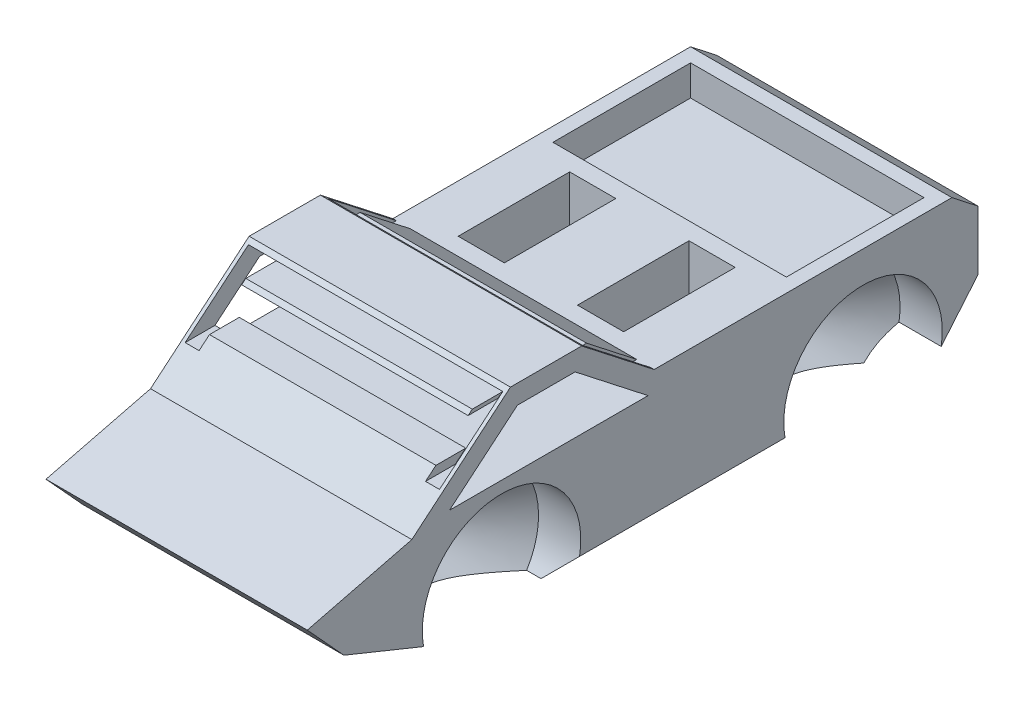
from build123d import *

# Parameters (mm, degrees)
BOSS_EXTRUDE1_DEPTH      = 15
CHAMFER1_SIZE            = 3.2
LPATTERN1_COUNT          = 2
LPATTERN1_PITCH          = 41.5
SKETCH4_W                = 5.3
SKETCH4_H                = 12.8
CUT_EXTRUDE1_DEPTH       = 81.375680401
SKETCH5_W                = 26.8
SKETCH5_H                = 15.8
CUT_EXTRUDE2_DEPTH       = 3.5
CUT_EXTRUDE_THIN11_REACH = 81.437
SKETCH6_W                = 26
SKETCH6_H                = 1.6


with BuildPart() as part:
    # Sketch1 → Boss-Extrude1 (new, symmetric)
    with BuildSketch(Plane(origin=(0, 0, 0), x_dir=(0, 0, -1), z_dir=(1, 0, 0))):
        Polygon((0, 0), (12, 3), (23.32165913, 12.5), (31.5, 12.5), (39.819620609, 6), (74, 6), (77, 3.65614312), (77, -3.157724852), (70, -11.5), (16, -11.5), (13.31488118, -8.3), (4.2, -4.6), align=None)
        Polygon((16.321122645, 3.753956381), (24.122393645, 10.3), (30.742479251, 10.3), (39.121033004, 3.753956381), align=None, mode=Mode.SUBTRACT)
    extrude(amount=BOSS_EXTRUDE1_DEPTH, both=True)

    # Chamfer1
    chamfer1_edges = [part.edges().sort_by_distance(p)[0] for p in [
        (-15, -11.5, -43),
        (15, -11.5, -43),
    ]]
    chamfer(chamfer1_edges, length=CHAMFER1_SIZE)

    # Sketch2 → Cut-Revolve1 (revolve, cut)
    with BuildSketch(Plane.XY.offset(-22.3)):
        Polygon((15, 2.4), (10.15, 2.4), (3.75, -4), (0, -4), (0, -6.7), (15, -6.7), align=None)
    cut_revolve1 = revolve(axis=Axis((0, -6.7, -22.3), (-1, 0, 0)), mode=Mode.SUBTRACT)

    # Mirror1: Cut-Revolve1 across plane
    add(cut_revolve1.mirror(Plane(origin=(0, 0, 0), x_dir=(0, 0, 1), z_dir=(1, 0, 0))), mode=Mode.SUBTRACT)

    # LPattern1: Cut-Revolve1 ×2
    with Locations(*[(0, 0, -i * LPATTERN1_PITCH) for i in range(1, LPATTERN1_COUNT)]):
        add(cut_revolve1, mode=Mode.SUBTRACT)

    # Mirror2 copy 1 sketch → Mirror2 copy 1 (revolve, cut)
    with BuildSketch(Plane(origin=(0, 0, -63.8), x_dir=(-1, 0, 0), z_dir=(0, 0, 1))):
        Polygon((15, -2.4), (10.15, -2.4), (3.75, 4), (0, 4), (0, 6.7), (15, 6.7), align=None)
    revolve(axis=Axis((0, -6.7, -63.8), (-1, 0, 0)), mode=Mode.SUBTRACT)

    # Mirror2 copy 2 sketch → Mirror2 copy 2 (revolve, cut)
    with BuildSketch(Plane(origin=(0, 0, -22.3), x_dir=(-1, 0, 0), z_dir=(0, 0, 1))):
        Polygon((15, -2.4), (10.15, -2.4), (3.75, 4), (0, 4), (0, 6.7), (15, 6.7), align=None)
    revolve(axis=Axis((0, -6.7, -22.3), (-1, 0, 0)), mode=Mode.SUBTRACT)

    # Sketch4 → Cut-Extrude1 (cut, through all)
    with BuildSketch(Plane(origin=(0, 6, 0), x_dir=(1, 0, 0), z_dir=(0, 1, 0))):
        with Locations((6.85, 48.219620609)):
            Rectangle(SKETCH4_W, SKETCH4_H)
    cut_extrude1 = extrude(amount=-CUT_EXTRUDE1_DEPTH, mode=Mode.SUBTRACT)

    # Mirror3: Cut-Extrude1 across plane
    add(cut_extrude1.mirror(Plane(origin=(0, 0, 0), x_dir=(0, 0, 1), z_dir=(1, 0, 0))), mode=Mode.SUBTRACT)

    # Sketch5 → Cut-Extrude2 (cut)
    with BuildSketch(Plane(origin=(0, 6, 0), x_dir=(1, 0, 0), z_dir=(0, 1, 0))):
        with Locations((0, 64.5)):
            Rectangle(SKETCH5_W, SKETCH5_H)
    extrude(amount=-CUT_EXTRUDE2_DEPTH, mode=Mode.SUBTRACT)

    # Sketch6 → Cut-Extrude-Thin11 (cut, up to next)
    with BuildSketch(Plane.XY, mode=Mode.PRIVATE) as cut_extrude_thin11_sk1:
        with Locations((0, 7.8)):
            Rectangle(SKETCH6_W, SKETCH6_H)
    cut_extrude_thin11_tool1 = extrude(cut_extrude_thin11_sk1.sketch, amount=-CUT_EXTRUDE_THIN11_REACH, mode=Mode.PRIVATE) & part.part
    # Sketch6 → Cut-Extrude-Thin11 (cut, up to next)
    with BuildSketch(Plane.XY, mode=Mode.PRIVATE) as cut_extrude_thin11_sk2:
        Polygon((13, 6), (13, 10.5), (-13, 10.5), (-13, 6), (-14.6, 6), (-14.6, 12.1), (14.6, 12.1), (14.6, 6), align=None)
    cut_extrude_thin11_tool2 = extrude(cut_extrude_thin11_sk2.sketch, amount=-CUT_EXTRUDE_THIN11_REACH, mode=Mode.PRIVATE) & part.part
    # Sketch6 → Cut-Extrude-Thin11 (cut, up to next)
    with BuildSketch(Plane.XY, mode=Mode.PRIVATE) as cut_extrude_thin11_sk3:
        with Locations((0, 9.3)):
            Rectangle(SKETCH6_W, SKETCH6_H)
    cut_extrude_thin11_tool3 = extrude(cut_extrude_thin11_sk3.sketch, amount=-CUT_EXTRUDE_THIN11_REACH, mode=Mode.PRIVATE) & part.part
    add(cut_extrude_thin11_tool1.solids().sort_by_distance((0, 7.8, 0))[0], mode=Mode.SUBTRACT)
    add(cut_extrude_thin11_tool2.solids().sort_by_distance((0, 10.581414, 0))[0], mode=Mode.SUBTRACT)
    add(cut_extrude_thin11_tool3.solids().sort_by_distance((0, 9.3, 0))[0], mode=Mode.SUBTRACT)


solid = part.part
